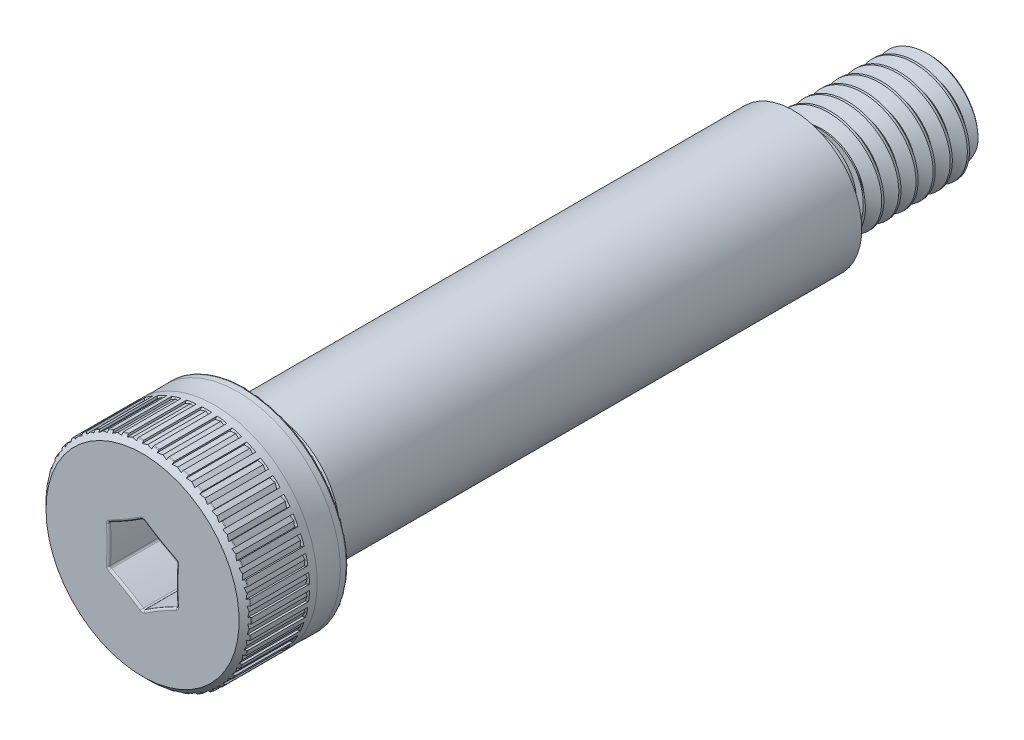
from build123d import *

# Parameters (mm, degrees)
SKETCH4_W             = 1.190625
SKETCH4_H             = 0.3175
SKETCH4_W_2           = 1.031875
SKETCH4_H_2           = 0.515555748
CHAMFER1_SIZE         = 0.3175
FILLET1_R             = 0.1905
FILLET2_R             = 0.15875
CHAMFER2_SIZE         = 0.1984375
CHAMFER3_SIZE         = 0.28575
CUT_EXTRUDE1_DEPTH    = 2.413
FILLET4_R             = 0.09525
DELETEFACE1_START     = -26.431875
DELETEFACE1_OUTLINE_W = 8
DELETEFACE1_OUTLINE_H = 8
DELETEFACE1_OUTLINE_R = 1.897444252
DELETEFACE1_DEPTH     = 0.1587501
CUT_SWEEP1_PITCH      = 0.79375
CUT_EXTRUDE2_REACH    = 39.128
CIRPATTERN1_COUNT     = 42
FILLET5_R             = 0.0508


# Read off the part's stored shape, not the designer's step: DeleteFace1, CirPattern2
with BuildPart() as part:
    # Sketch3 → Revolve1 (revolve)
    with BuildSketch(Plane(origin=(0, 0, 0), x_dir=(0, 0, -1), z_dir=(1, 0, 0)), mode=Mode.PRIVATE) as revolve1_sk:
        Polygon((-4.7625, 4.7625), (0, 4.7625), (0, 3.175), (25.4, 3.175), (25.4, 2.413), (31.75, 2.413), (31.75, 0), (-4.7625, 0), align=None)
    revolve(revolve1_sk.sketch.rotate(Axis((0, 0, 4.7625), (0, 0, -1)), 90), axis=Axis((0, 0, 4.7625), (0, 0, -1)))

    # Sketch4 → Cut-Revolve1 (revolve, cut)
    with BuildSketch(Plane(origin=(0, 0, 0), x_dir=(0, 0, -1), z_dir=(1, 0, 0)), mode=Mode.PRIVATE) as cut_revolve1_sk:
        with Locations((0.5953125, 3.01625)):
            Rectangle(SKETCH4_W, SKETCH4_H)
        with Locations((25.9159375, 2.155222126)):
            Rectangle(SKETCH4_W_2, SKETCH4_H_2)
    revolve(cut_revolve1_sk.sketch.rotate(Axis((0, 0, 4.7625), (0, 0, -1)), 90), axis=Axis((0, 0, 4.7625), (0, 0, -1)), mode=Mode.SUBTRACT)

    # Chamfer1
    chamfer1_edges = [part.edges().sort_by_distance(p)[0] for p in [
        (-2.8575, 0, -1.190625),
    ]]
    chamfer(chamfer1_edges, length=CHAMFER1_SIZE - 0.0001)  # a hair under: the kernel refuses the full size

    # Fillet1
    fillet1_edges = [part.edges().sort_by_distance(p)[0] for p in [
        (-2.8575, 0, 0),
    ]]
    fillet(fillet1_edges, radius=FILLET1_R)

    # Fillet2
    fillet2_edges = [part.edges().sort_by_distance(p)[0] for p in [
        (-1.897444252, 0, -25.4),
        (-1.897444252, 0, -26.431875),
    ]]
    fillet(fillet2_edges, radius=FILLET2_R)

    # Chamfer2
    chamfer2_edges = [part.edges().sort_by_distance(p)[0] for p in [
        (-2.413, 0, -26.431875),
        (-2.413, 0, -31.75),
    ]]
    chamfer(chamfer2_edges, length=CHAMFER2_SIZE)

    # Chamfer3
    chamfer3_edges = [part.edges().sort_by_distance(p)[0] for p in [
        (-4.7625, 0, 4.7625),
    ]]
    chamfer(chamfer3_edges, length=CHAMFER3_SIZE)

    # Sketch5 → Cut-Extrude1 (cut)
    with BuildSketch(Plane.XY.offset(4.7625)):
        with BuildLine():
            ThreePointArc((1.5875, 0.916543552), (0.777875, 1.347319022), (0, 1.833087105))
            ThreePointArc((0, 1.833087105), (-0.777875, 1.347319022), (-1.5875, 0.916543552))
            ThreePointArc((-1.5875, 0.916543552), (-1.55575, 0), (-1.5875, -0.916543552))
            ThreePointArc((-1.5875, -0.916543552), (-0.777875, -1.347319022), (0, -1.833087105))
            ThreePointArc((0, -1.833087105), (0.777875, -1.347319022), (1.5875, -0.916543552))
            ThreePointArc((1.5875, -0.916543552), (1.55575, 0), (1.5875, 0.916543552))
        make_face()
    extrude(amount=-CUT_EXTRUDE1_DEPTH, mode=Mode.SUBTRACT)

    # Fillet4
    fillet4_edges = [part.edges().sort_by_distance(p)[0] for p in [
        (1.55575, 0, 2.3495),
        (1.5875, 0.916543552, 3.556),
        (0.777875, -1.347319022, 2.3495),
        (1.5875, -0.916543552, 3.556),
        (-0.777875, -1.347319022, 2.3495),
        (0, -1.833087105, 3.556),
        (-1.55575, 0, 2.3495),
        (-1.5875, -0.916543552, 3.556),
        (-0.777875, 1.347319022, 2.3495),
        (-1.5875, 0.916543552, 3.556),
        (0.777875, 1.347319022, 2.3495),
        (0, 1.833087105, 3.556),
        (1.55575, 0, 4.7625),
        (0.777875, 1.347319022, 4.7625),
        (-0.777875, 1.347319022, 4.7625),
        (-1.55575, 0, 4.7625),
        (-0.777875, -1.347319022, 4.7625),
        (0.777875, -1.347319022, 4.7625),
        (-4.7625, 0, 0),
    ]]
    fillet(fillet4_edges, radius=FILLET4_R)

    # DeleteFace1 outline → DeleteFace1 (cut)
    with BuildSketch(Plane.XY.offset(DELETEFACE1_START)):
        Rectangle(DELETEFACE1_OUTLINE_W, DELETEFACE1_OUTLINE_H)
        Circle(DELETEFACE1_OUTLINE_R, mode=Mode.SUBTRACT)
    extrude(amount=DELETEFACE1_DEPTH, mode=Mode.SUBTRACT)

    # Cut-Sweep1: the profile of Sketch7 profile screwed along a right-hand helix of 7.48 turns, 8 arcs to a turn; built about Z, then put on its axis
    cut_sweep1_z = Axis((0, 0, 0), (0, 0, 1))
    cut_sweep1_corners = [(2.455962979, 0, 0.024804687), (2.455962979, 0, -0.719335938), (1.897144252, 0, -0.396701795), (1.897144252, 0, -0.297829455)]
    with BuildLine(mode=Mode.PRIVATE) as cut_sweep1_profile:
        Line(cut_sweep1_corners[0], cut_sweep1_corners[1])
        Line(cut_sweep1_corners[1], cut_sweep1_corners[2])
        Line(cut_sweep1_corners[2], cut_sweep1_corners[3])
        Line(cut_sweep1_corners[3], cut_sweep1_corners[0])
    cut_sweep1_cap = Face(cut_sweep1_profile.wire())
    cut_sweep1_turn_angles = [0, 22.5, 45, 67.5, 90, 112.5, 135, 157.5, 180, 202.5, 225, 247.5, 270, 292.5, 315, 337.5, 360]
    cut_sweep1_turn_weights = [1, 0.9238795325112867, 1, 0.9238795325112867, 1, 0.9238795325112867, 1, 0.9238795325112867, 1, 0.9238795325112867, 1, 0.9238795325112867, 1, 0.9238795325112867, 1, 0.9238795325112867, 1]
    cut_sweep1_turn_rails = [Edge.make_bspline([Vector(p[0], p[1], 0).rotate(cut_sweep1_z, cut_sweep1_turn_angles[k]) / cut_sweep1_turn_weights[k] + Vector(0, 0, p[2] + CUT_SWEEP1_PITCH * cut_sweep1_turn_angles[k] / 360) for k in range(17)], [0, 0, 0, 1, 1, 2, 2, 3, 3, 4, 4, 5, 5, 6, 6, 7, 7, 8, 8, 8], 2, cut_sweep1_turn_weights) for p in cut_sweep1_corners]
    cut_sweep1_turn_sides = [Face.make_surface_from_curves(cut_sweep1_turn_rails[p[0]], cut_sweep1_turn_rails[p[1]]) for p in [(0, 1), (1, 2), (2, 3), (3, 0)]]
    cut_sweep1_last_angles = [2520, 2542.5, 2565, 2587.5, 2610, 2632.5, 2655, 2673.9, 2692.8]
    cut_sweep1_last_weights = [1, 0.9238795325112867, 1, 0.9238795325112867, 1, 0.9238795325112867, 1, 0.9460853588275152, 1]
    cut_sweep1_last_rails = [Edge.make_bspline([Vector(p[0], p[1], 0).rotate(cut_sweep1_z, cut_sweep1_last_angles[k]) / cut_sweep1_last_weights[k] + Vector(0, 0, p[2] + CUT_SWEEP1_PITCH * cut_sweep1_last_angles[k] / 360) for k in range(9)], [0, 0, 0, 1, 1, 2, 2, 3, 3, 4, 4, 4], 2, cut_sweep1_last_weights) for p in cut_sweep1_corners]
    cut_sweep1_last_sides = [Face.make_surface_from_curves(cut_sweep1_last_rails[p[0]], cut_sweep1_last_rails[p[1]]) for p in [(0, 1), (1, 2), (2, 3), (3, 0)]]
    cut_sweep1 = Plane(origin=(0, 0, -31.75), x_dir=(0, 1, 0), z_dir=(0, 0, 1)) * Solid(Shell([*[p.moved(Location((0, 0, CUT_SWEEP1_PITCH * i))) for i in range(7) for p in cut_sweep1_turn_sides], *cut_sweep1_last_sides, cut_sweep1_cap, cut_sweep1_cap.rotate(cut_sweep1_z, 2692.8).moved(Location((0, 0, CUT_SWEEP1_PITCH * 2692.8 / 360)))]))
    add(cut_sweep1, mode=Mode.SUBTRACT)

    # Cut-Extrude2: up to this plane
    cut_extrude2_end = Plane(origin=(0, 5.814873764, 0.733563736), z_dir=(0, 0.707106781186546, 0.7071067811865491))
    # Sketch8 → Cut-Extrude2 (cut, up to the surface)
    with BuildSketch(Plane.XY.offset(4.7625), mode=Mode.PRIVATE) as cut_extrude2_sk1:
        Polygon((-0.2286, 4.7625), (0.2286, 4.7625), (0.218989269, 4.67106), (0, 4.71678), (-0.218989269, 4.67106), align=None)
    cut_extrude2_tool1 = split(extrude(cut_extrude2_sk1.sketch, amount=-CUT_EXTRUDE2_REACH, mode=Mode.PRIVATE), bisect_by=cut_extrude2_end, keep=Keep.BOTH, mode=Mode.PRIVATE)
    cut_extrude2 = cut_extrude2_tool1.solids().sort_by_distance((0, 4.727084, 4.7625))[0]
    add(cut_extrude2, mode=Mode.SUBTRACT)

    # CirPattern1: Cut-Extrude2 ×42 about axis
    cirpattern1_axis = Axis((0, 0, 0), (0, 0, 1))
    for i in range(1, CIRPATTERN1_COUNT):
        add(cut_extrude2.rotate(cirpattern1_axis, i * 360 / CIRPATTERN1_COUNT), mode=Mode.SUBTRACT)

    # Fillet5
    fillet5_edges = [part.edges().sort_by_distance(p)[0] for p in [
        (0.355902071, 4.749183084, 4.47675),
    ]]
    fillet(fillet5_edges, radius=FILLET5_R)

    # CirPattern2 outline → CirPattern2 (revolve, cut)
    with BuildSketch(Plane.XZ):
        with BuildLine():
            ThreePointArc((4.747621024, 4.491628976), (4.75863308, 4.47514827), (4.7625, 4.455707951))
            Line((4.7625, 4.455707951), (4.7625, 4.491628976))
            Line((4.7625, 4.491628976), (4.747621024, 4.491628976))
        make_face()
    revolve(axis=Axis((0, 0, 0), (0, 0, 1)), mode=Mode.SUBTRACT)

    # Sketch11 → Cut-Revolve6 (revolve, cut)
    with BuildSketch(Plane(origin=(0, 0, 0), x_dir=(0, 0, -1), z_dir=(1, 0, 0)), mode=Mode.PRIVATE) as cut_revolve6_sk:
        with BuildLine():
            Line((-1.42875, 4.7625), (-0.3571875, 4.7625))
            ThreePointArc((-0.3571875, 4.7625), (-0.89296875, 4.74472), (-1.42875, 4.7625))
        make_face()
    revolve(cut_revolve6_sk.sketch.rotate(Axis((0, 0, 4.7625), (0, 0, -1)), 90), axis=Axis((0, 0, 4.7625), (0, 0, -1)), mode=Mode.SUBTRACT)


solid = part.part
